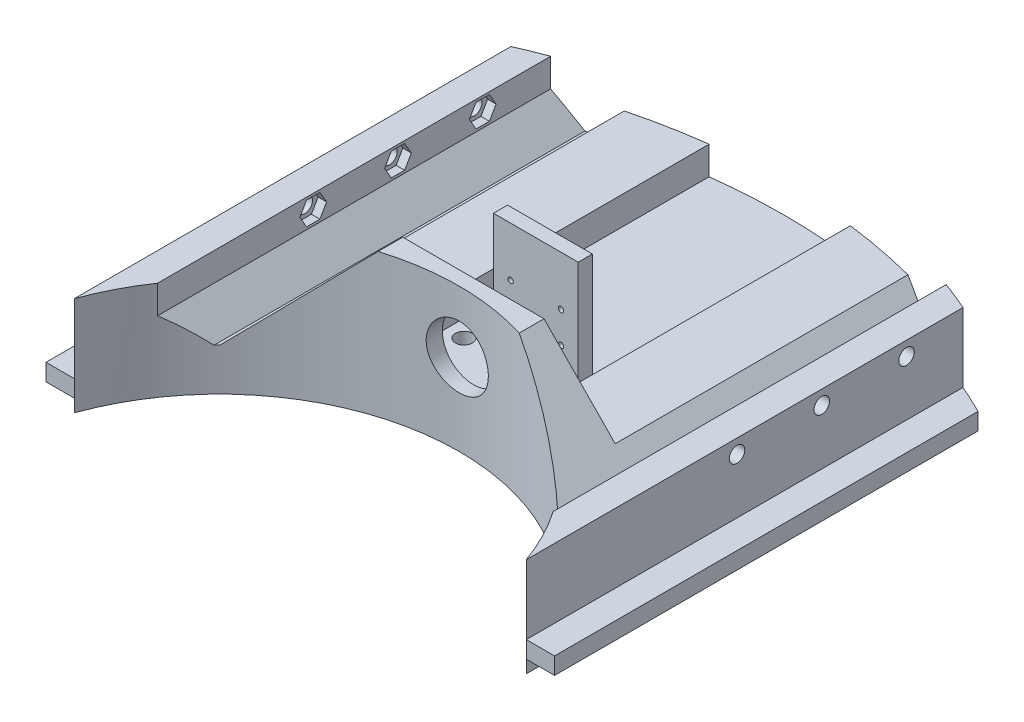
from build123d import *

# Parameters (mm, degrees)
SKETCH1_R                = 200
BOSS_EXTRUDE1_DEPTH      = 15
BOSS_EXTRUDE2_DEPTH      = 200
CUT_EXTRUDE1_DEPTH       = 286.087705803
CUT_EXTRUDE1_DEPTH_BACK  = 286.087705803
SKETCH3_R                = 85
CUT_EXTRUDE2_DEPTH       = 451.079120005
CUT_EXTRUDE2_DEPTH_BACK  = 451.079120005
SKETCH4_R                = 11
CUT_EXTRUDE3_DEPTH       = 451.079120105
CUT_EXTRUDE3_DEPTH_BACK  = 110
CUT_EXTRUDE4_DEPTH       = 110
BOSS_EXTRUDE3_DEPTH      = 200
CUT_EXTRUDE5_DEPTH       = 286.087705815
CUT_EXTRUDE5_DEPTH_BACK  = 286.087705815
SKETCH7_OUTSIDE_W        = 515.59
SKETCH7_OUTSIDE_H        = 515.59
SKETCH7_OUTSIDE_R        = 200
SKETCH9_R                = 4
BOSS_EXTRUDE4_DEPTH      = 220
CUT_EXTRUDE6_DEPTH       = 190
SKETCH11_R               = 3
CUT_EXTRUDE7_DEPTH       = 486.974499745
CUT_EXTRUDE8_DEPTH       = 302.61434707
CUT_EXTRUDE8_DEPTH_BACK  = 302.61434707
BOSS_EXTRUDE5_DEPTH      = 150
CUT_EXTRUDE9_DEPTH       = 262.287608345
CUT_EXTRUDE9_DEPTH_BACK  = 262.287608345
CUT_EXTRUDE10_DEPTH      = 259.795285906
CUT_EXTRUDE10_DEPTH_BACK = 259.795285906
SKETCH18_R               = 85
CUT_EXTRUDE11_START      = -15
CUT_EXTRUDE11_DEPTH      = 35
SKETCH20_R               = 2.75
CUT_EXTRUDE12_DEPTH      = 268.341007469
SKETCH21_W               = 30
SKETCH21_H               = 5
BOSS_EXTRUDE6_DEPTH      = 37
SKETCH22_R               = 0.95
CUT_EXTRUDE13_DEPTH      = 10
CUT_EXTRUDE14_DEPTH      = 3
LPATTERN1_COUNT          = 3
LPATTERN1_PITCH          = 30
CUT_EXTRUDE15_DEPTH      = 3
LPATTERN2_COUNT          = 3
LPATTERN2_PITCH          = 30
SKETCH25_R               = 3
CUT_EXTRUDE16_DEPTH      = 30


# Read off the part's stored shape, not the designer's step: Cut-Extrude11
with BuildPart() as part:
    # Sketch1 → Boss-Extrude1 (new body)
    with BuildSketch(Plane(origin=(0, 0, 0), x_dir=(1, 0, 0), z_dir=(0, 1, 0))):
        with Locations(Location((0, 0, 0), (0, 0, 270))):
            Circle(SKETCH1_R)
    extrude(amount=BOSS_EXTRUDE1_DEPTH)

    # Sketch2 → Boss-Extrude2 (add, symmetric)
    with BuildSketch(Plane.XY):
        Polygon((-25, 50.707142143), (25, 50.707142143), (60, 15), (-60, 15), align=None)
    extrude(amount=BOSS_EXTRUDE2_DEPTH, both=True)

    # Sketch3 → Cut-Extrude1 (cut, two sides: drawn at the far end of the back side and taken through both)
    with BuildSketch(Plane(origin=(0, 15, 0), x_dir=(1, 0, 0), z_dir=(0, 1, 0)).offset(-CUT_EXTRUDE1_DEPTH_BACK)):
        with Locations(Location((0, 0, 0), (0, 0, 270))):
            Circle(SKETCH3_R)
    extrude(amount=CUT_EXTRUDE1_DEPTH + CUT_EXTRUDE1_DEPTH_BACK, mode=Mode.SUBTRACT)

    # Sketch4 → Cut-Extrude2 (cut, two sides: drawn at the far end of the back side and taken through both)
    with BuildSketch(Plane(origin=(0, 0, -200), x_dir=(-1, 0, 0), z_dir=(0, 0, -1)).offset(-CUT_EXTRUDE2_DEPTH_BACK)):
        with Locations((0, 29)):
            Circle(SKETCH4_R)
    extrude(amount=CUT_EXTRUDE2_DEPTH + CUT_EXTRUDE2_DEPTH_BACK, mode=Mode.SUBTRACT)

    # Sketch5 → Cut-Extrude3 (cut, two sides: drawn at the far end of the back side and taken through both)
    with BuildSketch(Plane.XY.offset(200).offset(-CUT_EXTRUDE3_DEPTH_BACK)):
        Polygon((-25, 50.707142143), (25, 50.707142143), (50.198039412, 25), (25, 25), (25, 15), (-25, 15), (-25, 25), (-50.198039412, 25), align=None)
    extrude(amount=CUT_EXTRUDE3_DEPTH + CUT_EXTRUDE3_DEPTH_BACK, mode=Mode.SUBTRACT)

    # Sketch6 → Cut-Extrude4 (cut)
    with BuildSketch(Plane(origin=(0, 0, -200), x_dir=(-1, 0, 0), z_dir=(0, 0, -1))):
        Polygon((-25, 50.707142143), (25, 50.707142143), (50.198039412, 25), (25, 25), (25, 15), (-25, 15), (-25, 25), (-50.198039412, 25), align=None)
    extrude(amount=-CUT_EXTRUDE4_DEPTH, mode=Mode.SUBTRACT)

    # Sketch8 → Boss-Extrude3 (add, symmetric)
    with BuildSketch(Plane(origin=(0, 0, 0), x_dir=(0, 0, -1), z_dir=(1, 0, 0))):
        Polygon((0, 15), (-20, 15), (-10, 35.712315177), (10, 35.712315177), (20, 15), align=None)
    extrude(amount=BOSS_EXTRUDE3_DEPTH, both=True)

    # Sketch7 outside → Cut-Extrude5 (cut, two sides: drawn at the far end of the back side and taken through both)
    with BuildSketch(Plane(origin=(0, 15, 0), x_dir=(1, 0, 0), z_dir=(0, 1, 0)).offset(-CUT_EXTRUDE5_DEPTH_BACK)):
        Rectangle(SKETCH7_OUTSIDE_W, SKETCH7_OUTSIDE_H)
        with Locations(Location((0, 0, 0), (0, 0, 97.180755781))):
            Circle(SKETCH7_OUTSIDE_R, mode=Mode.SUBTRACT)
    extrude(amount=CUT_EXTRUDE5_DEPTH + CUT_EXTRUDE5_DEPTH_BACK, mode=Mode.SUBTRACT)

    # Sketch9 → Boss-Extrude4 (add, symmetric)
    with BuildSketch(Plane(origin=(0, 0, 0), x_dir=(0, 0, -1), z_dir=(1, 0, 0))):
        with Locations(Location((0, 29, 0), (0, 0, 180))):
            Circle(SKETCH9_R)
    extrude(amount=BOSS_EXTRUDE4_DEPTH, both=True)

    # Sketch10 → Cut-Extrude6 (cut, symmetric)
    with BuildSketch(Plane(origin=(0, 0, 0), x_dir=(0, 0, -1), z_dir=(1, 0, 0))):
        Polygon((-20, 15), (20, 15), (10, 35.712315177), (-10, 35.712315177), align=None)
    extrude(amount=CUT_EXTRUDE6_DEPTH, both=True, mode=Mode.SUBTRACT)

    # Sketch11 → Cut-Extrude7 (cut, through all)
    with BuildSketch(Plane.ZY.offset(220)):
        with Locations((0, 29)):
            Circle(SKETCH11_R)
    extrude(amount=-CUT_EXTRUDE7_DEPTH, mode=Mode.SUBTRACT)

    # Sketch14 → Cut-Extrude8 (cut, two sides: drawn at the far end of the back side and taken through both)
    with BuildSketch(Plane(origin=(0, 0, 0), x_dir=(1, 0, 0), z_dir=(0, 1, 0)).offset(-CUT_EXTRUDE8_DEPTH_BACK)):
        Polygon((-80, 28.722813233), (-80, 204.683452683), (-270.013244013, 28.722813233), (-103.583737584, -216.10995611), (187.046893047, -216.10995611), (266.535612536, 150.034958035), (80, 209.154693155), (80, 28.722813233), align=None)
    extrude(amount=CUT_EXTRUDE8_DEPTH + CUT_EXTRUDE8_DEPTH_BACK, mode=Mode.SUBTRACT)

    # Sketch16 → Boss-Extrude5 (add, symmetric)
    with BuildSketch(Plane(origin=(0, 0, -90), x_dir=(-1, 0, 0), z_dir=(0, 0, -1))):
        Polygon((-80, 15), (-80, 35), (-70, 35), (-70, 25), (-61, 15), (-61, 0), (-80, 0), (-80, 4.5), (-90, 4.5), (-90, 10.5), (-80, 10.5), align=None)
        Polygon((80, 15), (80, 35), (70, 35), (70, 25), (61, 15), (61, 0), (80, 0), (80, 4.5), (90, 4.5), (90, 10.5), (80, 10.5), align=None)
    extrude(amount=BOSS_EXTRUDE5_DEPTH, both=True)

    # Sketch17 → Cut-Extrude9 (cut, two sides: drawn at the far end of the back side and taken through both)
    with BuildSketch(Plane(origin=(0, 0, 0), x_dir=(1, 0, 0), z_dir=(0, 1, 0)).offset(-CUT_EXTRUDE9_DEPTH_BACK)):
        Polygon((-80, 28.722813233), (-99.608008808, 28.722813233), (-99.608008808, -74.271563426), (112.245925984, -74.271563426), (112.245925984, 0), (109.222119936, 28.722813233), (80, 28.722813233), align=None)
    extrude(amount=CUT_EXTRUDE9_DEPTH + CUT_EXTRUDE9_DEPTH_BACK, mode=Mode.SUBTRACT)

    # Sketch18 → Cut-Extrude10 (cut, two sides: drawn at the far end of the back side and taken through both)
    with BuildSketch(Plane(origin=(0, 15, 0), x_dir=(1, 0, 0), z_dir=(0, 1, 0)).offset(-CUT_EXTRUDE10_DEPTH_BACK)):
        Circle(SKETCH18_R)
    extrude(amount=CUT_EXTRUDE10_DEPTH + CUT_EXTRUDE10_DEPTH_BACK, mode=Mode.SUBTRACT)

    # Cut-Extrude11 outline → Cut-Extrude11 (cut)
    with BuildSketch(Plane(origin=(0, 15, 0), x_dir=(1, 0, 0), z_dir=(0, 1, 0)).offset(CUT_EXTRUDE11_START)):
        with BuildLine():
            Line((61, 240), (61, 190.470470152))
            ThreePointArc((61, 190.470470152), (75.732708439, 185.106879593), (90, 178.605710995))
            Line((90, 178.605710995), (90, 240))
            Line((90, 240), (61, 240))
        make_face()
        with BuildLine():
            Line((-61, 190.470470152), (-61, 240))
            Line((-61, 240), (-90, 240))
            Line((-90, 240), (-90, 178.605710995))
            ThreePointArc((-90, 178.605710995), (-75.732708439, 185.106879593), (-61, 190.470470152))
        make_face()
    extrude(amount=CUT_EXTRUDE11_DEPTH, mode=Mode.SUBTRACT)

    # Sketch20 → Cut-Extrude12 (cut, through all)
    with BuildSketch(Plane.ZY.offset(80)):
        with Locations((-163.303027798, 30)):
            Circle(SKETCH20_R)
        with Locations((-103.303027798, 30)):
            Circle(SKETCH20_R)
        with Locations((-133.303027798, 30)):
            Circle(SKETCH20_R)
    extrude(amount=-CUT_EXTRUDE12_DEPTH, mode=Mode.SUBTRACT)

    # Sketch21 → Boss-Extrude6 (add)
    with BuildSketch(Plane(origin=(0, 15, 0), x_dir=(1, 0, 0), z_dir=(0, 1, 0))):
        with Locations((0, 114.6)):
            Rectangle(SKETCH21_W, SKETCH21_H)
    extrude(amount=BOSS_EXTRUDE6_DEPTH)

    # Sketch22 → Cut-Extrude13 (cut)
    with BuildSketch(Plane(origin=(0, 0, -117.1), x_dir=(-1, 0, 0), z_dir=(0, 0, -1))):
        with Locations((-8.93, 23.49)):
            Circle(SKETCH22_R)
        with Locations((8.93, 23.49)):
            Circle(SKETCH22_R)
        with Locations((8.93, 34.49)):
            Circle(SKETCH22_R)
        with Locations((-8.93, 34.49)):
            Circle(SKETCH22_R)
    extrude(amount=-CUT_EXTRUDE13_DEPTH, mode=Mode.SUBTRACT)

    # Sketch23 → Cut-Extrude14 (cut)
    with BuildSketch(Plane(origin=(-70, 0, 0), x_dir=(0, 0, -1), z_dir=(1, 0, 0))):
        Polygon((103.303027798, 34.1), (105.668027798, 34.1), (108.035163902, 30), (105.668027798, 25.9), (103.303027798, 25.9), (100.938027798, 25.9), (98.570891695, 30), (100.938027798, 34.1), align=None)
    cut_extrude14 = extrude(amount=-CUT_EXTRUDE14_DEPTH, mode=Mode.SUBTRACT)

    # LPattern1: Cut-Extrude14 ×3
    with Locations(*[(0, 0, -i * LPATTERN1_PITCH) for i in range(1, LPATTERN1_COUNT)]):
        add(cut_extrude14, mode=Mode.SUBTRACT)

    # Sketch24 → Cut-Extrude15 (cut)
    with BuildSketch(Plane.ZY.offset(-70)):
        Polygon((-163.303027798, 34.09260032), (-160.933027798, 34.09260032), (-158.568027798, 29.99630016), (-160.933027798, 25.9), (-163.303027798, 25.9), (-165.673027798, 25.9), (-168.038027798, 29.99630016), (-165.673027798, 34.09260032), align=None)
    cut_extrude15 = extrude(amount=-CUT_EXTRUDE15_DEPTH, mode=Mode.SUBTRACT)

    # LPattern2: Cut-Extrude15 ×3
    with Locations(*[(0, 0, i * LPATTERN2_PITCH) for i in range(1, LPATTERN2_COUNT)]):
        add(cut_extrude15, mode=Mode.SUBTRACT)

    # Sketch25 → Cut-Extrude16 (cut)
    with BuildSketch(Plane(origin=(0, 15, 0), x_dir=(1, 0, 0), z_dir=(0, 1, 0))):
        with Locations(Location((-18.923887281, 105.579050088, 0), (0, 0, 270))):
            Circle(SKETCH25_R)
    extrude(amount=-CUT_EXTRUDE16_DEPTH, mode=Mode.SUBTRACT)


solid = part.part
